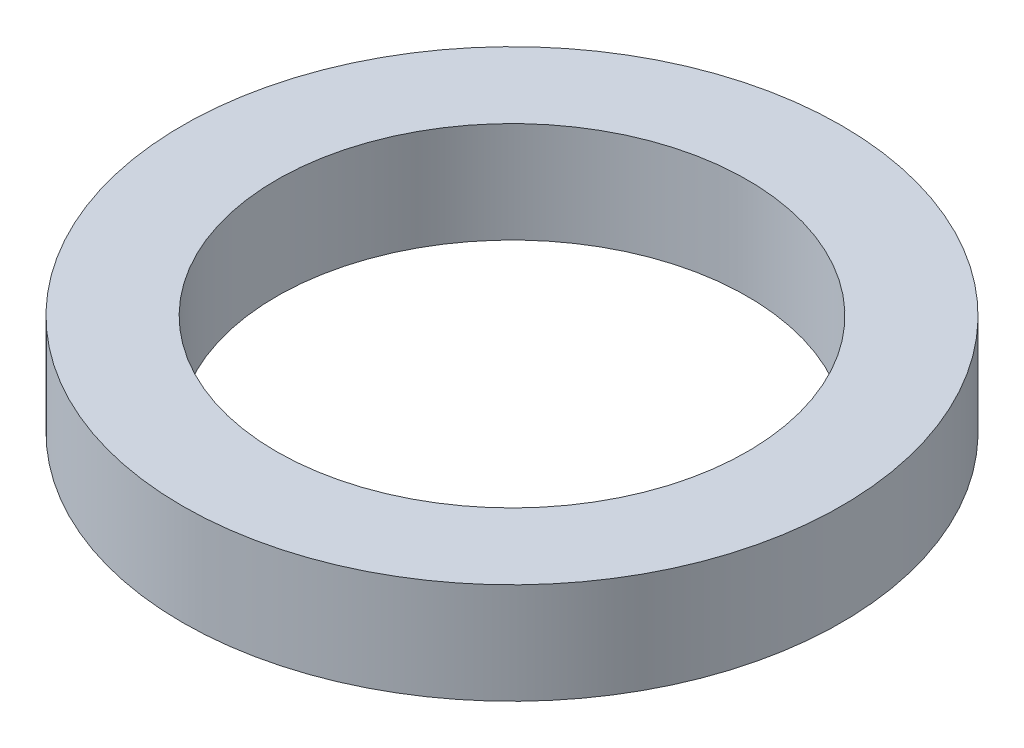
from build123d import *

# Parameters (mm, degrees)
SKETCH1_R           = 4.9
SKETCH1_R_2         = 3.5
BOSS_EXTRUDE1_DEPTH = 1.5


with BuildPart() as part:
    # Sketch1 → Boss-Extrude1 (new body)
    with BuildSketch(Plane(origin=(0, 0, 0), x_dir=(1, 0, 0), z_dir=(0, 1, 0))):
        Circle(SKETCH1_R)
        Circle(SKETCH1_R_2, mode=Mode.SUBTRACT)
    extrude(amount=BOSS_EXTRUDE1_DEPTH)


solid = part.part
